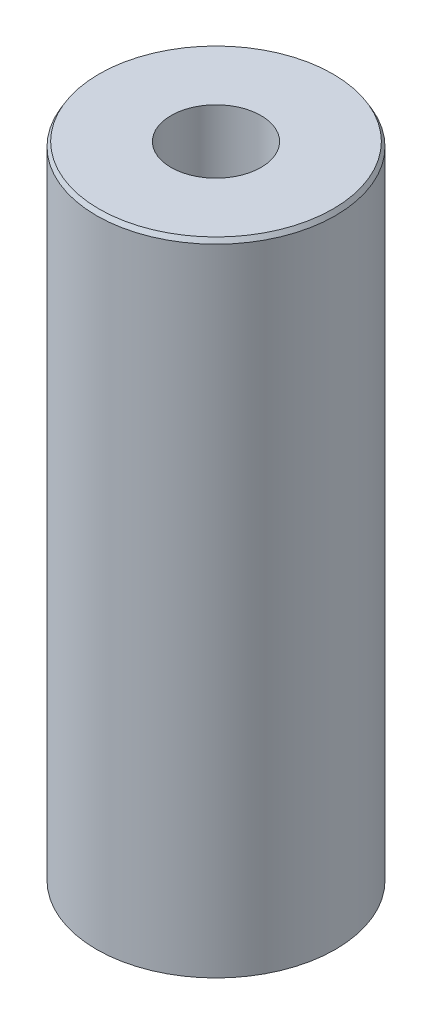
from build123d import *
from OCP.BRepFilletAPI import BRepFilletAPI_MakeChamfer

# Parameters (mm, degrees)
SKETCH1_R           = 47.5
BOSS_EXTRUDE1_DEPTH = 255.362633631
SKETCH2_R           = 17.882510519
CUT_EXTRUDE1_DEPTH  = 265.050325989
CHAMFER1_SIZE       = 1.769879592
CHAMFER1_SIZE2      = 1.015112138


with BuildPart() as part:
    # Sketch1 → Boss-Extrude1 (new body)
    with BuildSketch(Plane(origin=(0, 0, 0), x_dir=(1, 0, 0), z_dir=(0, 1, 0))):
        Circle(SKETCH1_R)
    extrude(amount=BOSS_EXTRUDE1_DEPTH)

    # Sketch2 → Cut-Extrude1 (cut, through all)
    with BuildSketch(Plane(origin=(0, 0, 0), x_dir=(1, 0, 0), z_dir=(0, 1, 0))):
        Circle(SKETCH2_R)
    extrude(amount=CUT_EXTRUDE1_DEPTH, mode=Mode.SUBTRACT)

    # Chamfer1: one chamfer whose edges measure the first distance from different faces: ONE call of the kernel's chamfer builder (chamfer() names one face for all edges)
    chamfer1_edges_1 = [part.edges().sort_by_distance(p)[0] for p in [
        (-47.5, 255.362633631, 0),
    ]]
    chamfer1_side_1 = [part.faces().sort_by_distance(p)[0] for p in [
        (-47.5, 127.681316815, 0),
    ]]
    chamfer1_edges_2 = [part.edges().sort_by_distance(p)[0] for p in [
        (-47.5, 0, 0),
    ]]
    chamfer1_side_2 = [part.faces().sort_by_distance(p)[0] for p in [
        (-46.156497116, 0, 0),
    ]]
    chamfer1 = BRepFilletAPI_MakeChamfer(part.part.solid().wrapped)
    for e in chamfer1_edges_1:
        chamfer1.Add(CHAMFER1_SIZE, CHAMFER1_SIZE2, e.wrapped, chamfer1_side_1[0].wrapped)  # the first distance lies on this face
    for e in chamfer1_edges_2:
        chamfer1.Add(CHAMFER1_SIZE, CHAMFER1_SIZE2, e.wrapped, chamfer1_side_2[0].wrapped)  # the first distance lies on this face
    add(Compound.cast(chamfer1.Shape()), mode=Mode.REPLACE)


solid = part.part
